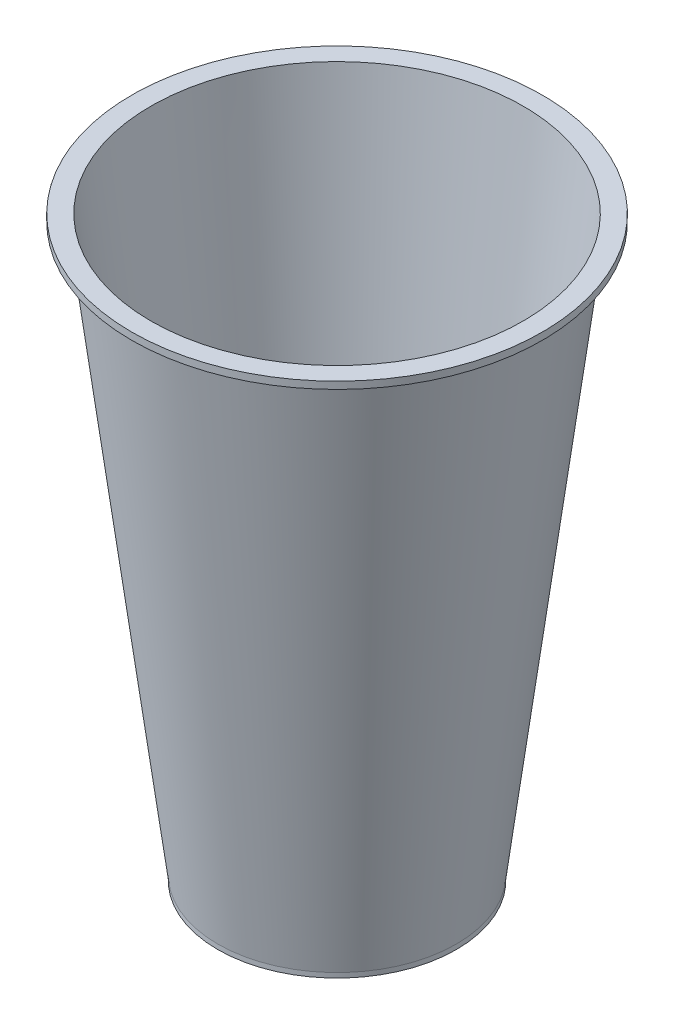
from build123d import *

# Parameters (mm, degrees)
SKETCH5_R           = 25
BOSS_EXTRUDE1_DEPTH = 1


# Read off the part's stored shape, not the designer's step: Loft-Thin1
with BuildPart() as part:
    # Loft-Thin1 outline → Loft-Thin1 (revolve)
    with BuildSketch(Plane.XY):
        Polygon((38.992217781, 120), (23.992217781, 0), (25, 0), (40, 120), align=None)
    revolve(axis=Axis((0, 0, 0), (0, 1, 0)))

    # Sketch5 → Boss-Extrude1 (add)
    with BuildSketch(Plane.XZ):
        with Locations(Location((0, 0, 0), (0, 0, 270))):
            Circle(SKETCH5_R)
    extrude(amount=BOSS_EXTRUDE1_DEPTH)

    # Sketch6 → Revolve1 (revolve)
    with BuildSketch(Plane.XY, mode=Mode.PRIVATE) as revolve1_sk:
        Polygon((40, 120), (43, 120), (43, 118.5), (42.5, 118.5), (42.5, 119.5), (40, 119.5), (39.9375, 119.5), align=None)
    revolve(revolve1_sk.sketch.rotate(Axis((0, 120, 0), (0, -1, 0)), 90), axis=Axis((0, 120, 0), (0, -1, 0)))


solid = part.part
